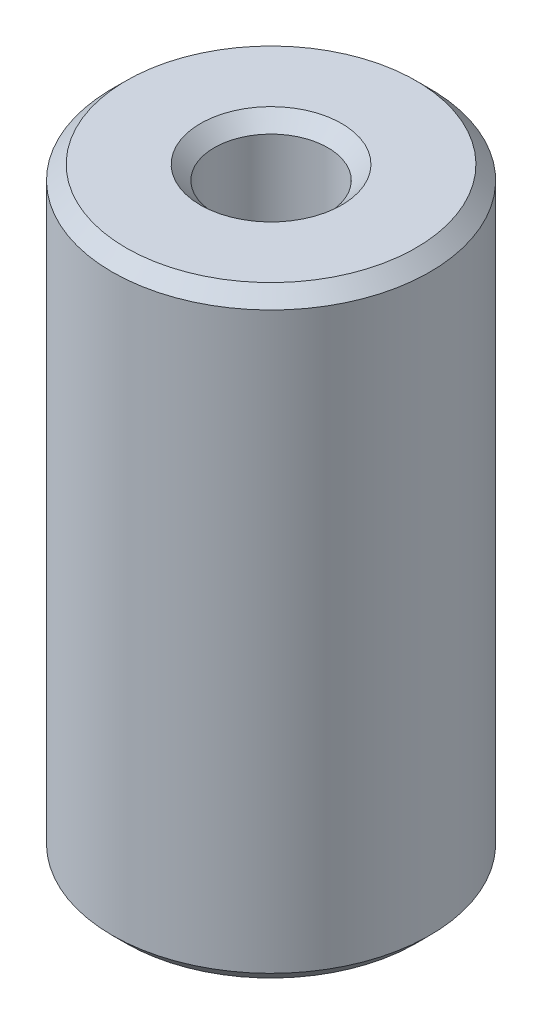
from build123d import *

# Parameters (mm, degrees)
SKETCH1_R           = 7.5
BOSS_EXTRUDE1_DEPTH = 28.443740329
SKETCH2_R           = 2.679582114
CUT_EXTRUDE1_DEPTH  = 31.356982128
CHAMFER1_SIZE       = 0.657564701


with BuildPart() as part:
    # Sketch1 → Boss-Extrude1 (new body)
    with BuildSketch(Plane(origin=(0, 0, 0), x_dir=(1, 0, 0), z_dir=(0, 1, 0))):
        Circle(SKETCH1_R)
    extrude(amount=BOSS_EXTRUDE1_DEPTH)

    # Sketch2 → Cut-Extrude1 (cut, through all)
    with BuildSketch(Plane(origin=(0, 0, 0), x_dir=(1, 0, 0), z_dir=(0, 1, 0))):
        Circle(SKETCH2_R)
    extrude(amount=CUT_EXTRUDE1_DEPTH, mode=Mode.SUBTRACT)

    # Chamfer1
    chamfer1_edges = [part.edges().sort_by_distance(p)[0] for p in [
        (-2.679582114, 28.443740329, 0),
        (-2.679582114, 0, 0),
        (-7.5, 0, 0),
        (-7.5, 28.443740329, 0),
    ]]
    chamfer(chamfer1_edges, length=CHAMFER1_SIZE)


solid = part.part
